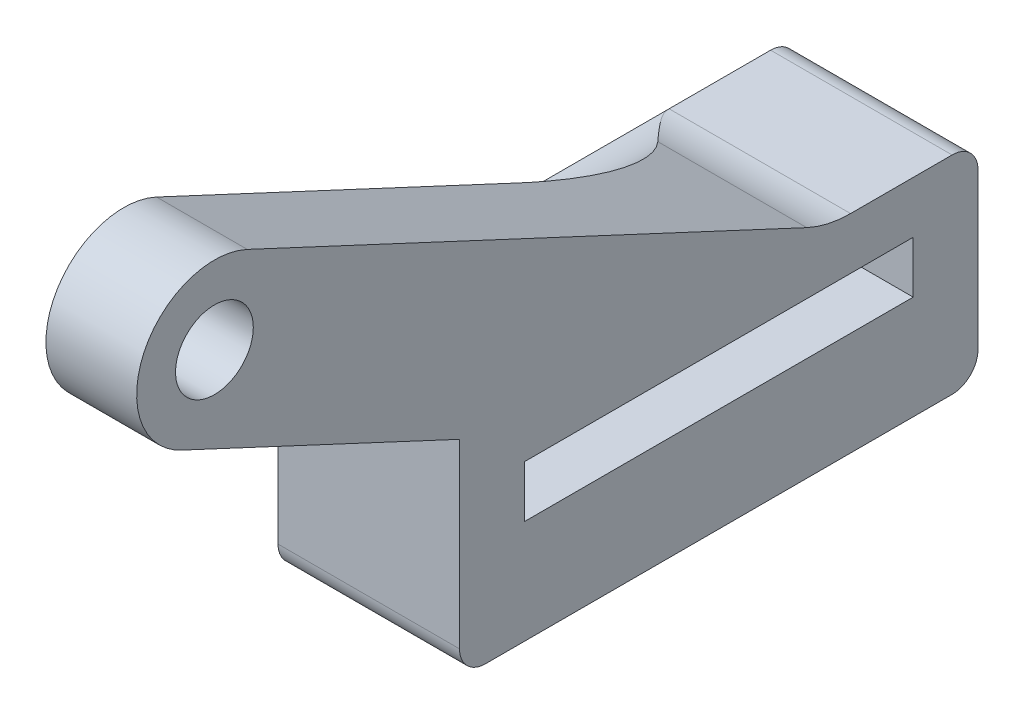
from build123d import *

# Parameters (mm, degrees)
CROQUIS1_R              = 1.5
CROQUIS1_W              = 15
CROQUIS1_H              = 2
SALIENTE_EXTRUIR1_DEPTH = 3.5
CORTAR_EXTRUIR1_START   = -3.5
CORTAR_EXTRUIR1_DEPTH   = 3.5
REDONDEO1_R             = 4
REDONDEO3_R             = 1


with BuildPart() as part:
    # Croquis1 → Saliente-Extruir1 (new, symmetric)
    with BuildSketch(Plane(origin=(0, 0, 0), x_dir=(0, 0, -1), z_dir=(1, 0, 0))):
        with BuildLine():
            Line((4.197209499, 4), (-18.186825032, 14.437846722))
            ThreePointArc((-18.186825032, 14.437846722), (-22.173603178, 12.986778146), (-20.722534603, 9))
            Line((-20.722534603, 9), (-10, 4))
            Line((-10, 4), (-10, -4))
            Line((-10, -4), (10, -4))
            Line((10, -4), (10, 4))
            Line((10, 4), (4.197209499, 4))
        make_face()
        with Locations((-19.454679817, 11.718923361)):
            Circle(CROQUIS1_R, mode=Mode.SUBTRACT)
        with Locations((0, 1)):
            Rectangle(CROQUIS1_W, CROQUIS1_H, mode=Mode.SUBTRACT)
    extrude(amount=SALIENTE_EXTRUIR1_DEPTH, both=True)

    # Croquis2 → Cortar-Extruir1 (cut)
    with BuildSketch(Plane.ZY.offset(3.5).offset(CORTAR_EXTRUIR1_START)):
        with BuildLine():
            Line((-4.197209499, 4), (10, 4))
            Line((10, 4), (20.722534603, 9))
            ThreePointArc((20.722534603, 9), (22.173603178, 12.986778146), (18.186825032, 14.437846722))
            Line((18.186825032, 14.437846722), (-4.197209499, 4))
        make_face()
    extrude(amount=CORTAR_EXTRUIR1_DEPTH, mode=Mode.SUBTRACT)

    # Redondeo1
    # the kernel refuses this fillet: 4 mm, written as the material it adds along each edge
    with BuildSketch(Plane(origin=(0, 4, -14.118776915), x_dir=(-1, 0, 0), z_dir=(0, 0, 1))) as redondeo1_piece_1_section:
        with BuildLine():
            CenterArc((4, -3.968626967), REDONDEO1_R, 97.180755781, 82.819244219)
            Line((0, -3.968626967), (0, 0))
            Line((0, 0), (3.5, 0))
        make_face()
    redondeo1_piece_1 = extrude(amount=24.118776915, mode=Mode.PRIVATE)
    redondeo1_piece_1 = split(redondeo1_piece_1, bisect_by=Plane(origin=(0, 0.199819207, -12.346723509), z_dir=(0, -0.9063077870366529, 0.42261826174069317)), keep=Keep.TOP, mode=Mode.PRIVATE)
    redondeo1_piece_1 = split(redondeo1_piece_1, bisect_by=Plane(origin=(0, -5.238027515, -9.811013939), z_dir=(0, 0.9063077870366527, -0.4226182617406936)), keep=Keep.TOP, mode=Mode.PRIVATE)
    add(redondeo1_piece_1)
    with BuildSketch(Plane(origin=(0, 4, -14.118776915), x_dir=(-1, 0, 0), z_dir=(0, 0, 1))) as redondeo1_piece_2_section:
        with BuildLine():
            CenterArc((4, -3.968626967), REDONDEO1_R, 97.180755781, 82.819244219)
            Line((0, -3.968626967), (0, 0))
            Line((0, 0), (3.5, 0))
        make_face()
    redondeo1_piece_2 = extrude(amount=34.040344332, mode=Mode.PRIVATE)
    redondeo1_piece_2 = split(redondeo1_piece_2, bisect_by=Plane(origin=(0, 4, 10), z_dir=(0, 0, 1)), keep=Keep.TOP, mode=Mode.PRIVATE)
    redondeo1_piece_2 = split(redondeo1_piece_2, bisect_by=Plane(origin=(0, -5.238027515, -9.811013939), z_dir=(0, 0.9063077870366527, -0.4226182617406936)), keep=Keep.TOP, mode=Mode.PRIVATE)
    add(redondeo1_piece_2)
    # the kernel refuses this fillet: 4 mm, written as the material it adds along each edge
    with BuildSketch(Plane(origin=(-3.5, 4, -4.197209499), x_dir=(0, 0, -1), z_dir=(1, 0, 0))) as redondeo1_2_piece_1_section:
        with BuildLine():
            CenterArc((REDONDEO1_R * 0.221694662643, REDONDEO1_R), REDONDEO1_R, 245, 25)
            Line((-REDONDEO1_R * 0.200923599098, REDONDEO1_R * 0.0936922129633), (0, 0))
            Line((0, 0), (REDONDEO1_R * 0.221694662643, 0))
        make_face()
    redondeo1_2_piece_1 = extrude(amount=7, mode=Mode.PRIVATE)
    redondeo1_2_piece_1 = redondeo1_2_piece_1 - Plane(origin=(-4, 7.968626967, -4.197209499), x_dir=(0.12499999999999983, -0.9921567416492215, 0), z_dir=(0, 0, -1)) * Cylinder(4, 18, mode=Mode.PRIVATE)
    add(redondeo1_2_piece_1)

    # Redondeo3
    redondeo3_edges = [part.edges().sort_by_distance(p)[0] for p in [
        (0, -4, -10),
        (0, -4, 10),
        (0, 4, -10),
    ]]
    fillet(redondeo3_edges, radius=REDONDEO3_R)


solid = part.part
